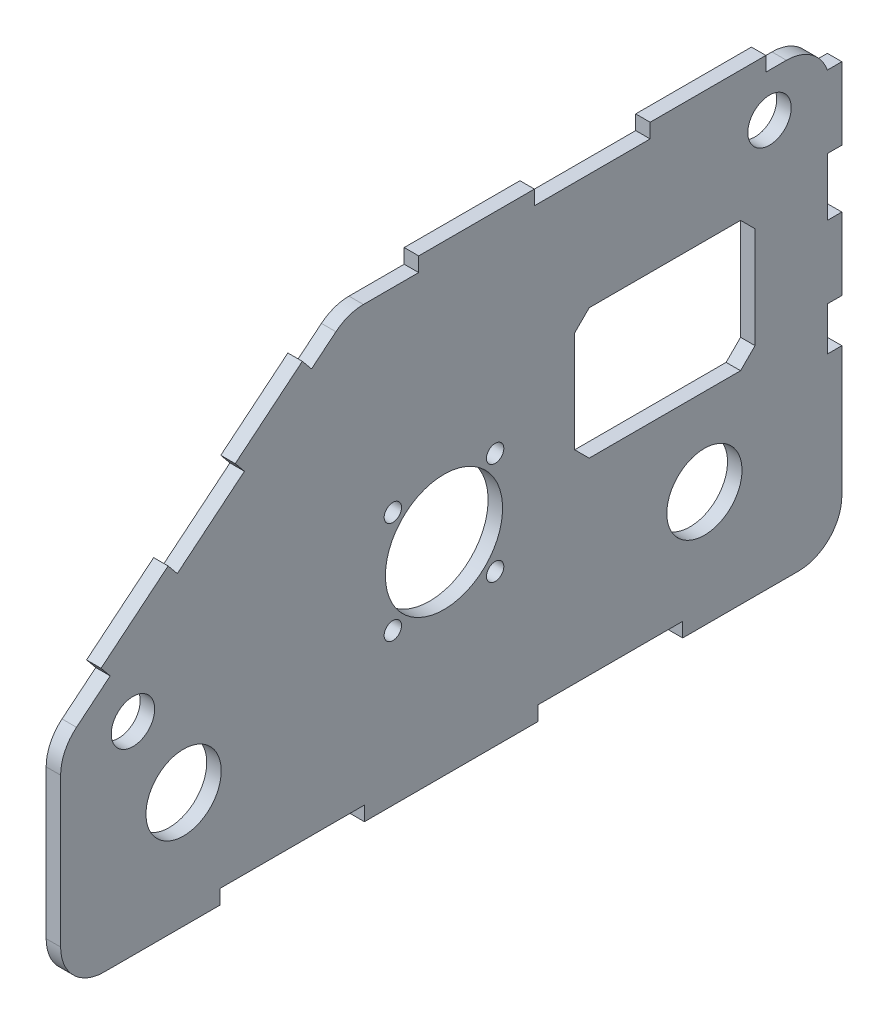
from build123d import *

# Parameters (mm, degrees)
ESQUISSE1_R             = 15
BOSS_EXTRU_1_DEPTH      = 10
ESQUISSE5_R             = 40.5
ESQUISSE5_R_2           = 6
ENL_V_MAT_EXTRU_1_DEPTH = 10
ESQUISSE6_R             = 26
ENL_V_MAT_EXTRU_2_DEPTH = 10
ENL_V_MAT_EXTRU_3_DEPTH = 10
CONG_1_R                = 30
ENL_V_MAT_EXTRU_4_DEPTH = 10


with BuildPart() as part:
    # Esquisse1 → Boss.-Extru.1 (new body)
    with BuildSketch(Plane(origin=(0, 0, 0), x_dir=(0, 0, -1), z_dir=(1, 0, 0))):
        Polygon((540, 0), (540, 310), (195, 310), (0, 150), (0, 0), (0, -10), (110, -10), (110, 0), (210, 0), (210, -10), (330, -10), (330, 0), (430, 0), (430, -10), (540, -10), align=None)
        with Locations((490, 270)):
            Circle(ESQUISSE1_R, mode=Mode.SUBTRACT)
        with Locations((50, 130)):
            Circle(ESQUISSE1_R, mode=Mode.SUBTRACT)
    extrude(amount=BOSS_EXTRU_1_DEPTH)

    # Esquisse5 → Enlèv. mat.-Extru.1 (cut)
    with BuildSketch(Plane.ZY):
        with Locations((-265, 130)):
            Circle(ESQUISSE5_R)
        with Locations((-300.35, 94.65)):
            Circle(ESQUISSE5_R_2)
        with Locations((-300.35, 165.35)):
            Circle(ESQUISSE5_R_2)
        with Locations((-229.65, 165.35)):
            Circle(ESQUISSE5_R_2)
        with Locations((-229.65, 94.65)):
            Circle(ESQUISSE5_R_2)
    extrude(amount=-ENL_V_MAT_EXTRU_1_DEPTH, mode=Mode.SUBTRACT)

    # Esquisse6 → Enlèv. mat.-Extru.2 (cut)
    with BuildSketch(Plane.ZY):
        with Locations((-445, 70)):
            Circle(ESQUISSE6_R)
        with Locations(Location((-85, 70, 0), (0, 0, 180))):
            Circle(ESQUISSE6_R)
    extrude(amount=-ENL_V_MAT_EXTRU_2_DEPTH, mode=Mode.SUBTRACT)

    # Esquisse7 → Enlèv. mat.-Extru.3 (cut)
    with BuildSketch(Plane.ZY):
        Polygon((-198.57749782, 300), (-247.5, 300), (-247.5, 310), (-327.5, 310), (-327.5, 300), (-407.5, 300), (-407.5, 310), (-487.5, 310), (-487.5, 300), (-530, 300), (-530, 280), (-540, 280), (-540, 230), (-530, 230), (-530, 190), (-540, 190), (-540, 140), (-530, 140), (-530, 110), (-794.780536076, 110), (-794.780536076, 495.732813741), (95.631773419, 495.732813741), (95.631773419, 137.064617174), (0, 137.064617174), (-34.266562773, 165.180771244), (-27.923396657, 172.911504949), (-74.307798886, 210.97050165), (-80.650965002, 203.239767945), (-127.035367231, 241.298764646), (-120.692201114, 249.02949835), (-167.076603343, 287.088495051), (-173.41976946, 279.357761346), align=None)
    extrude(amount=-ENL_V_MAT_EXTRU_3_DEPTH, mode=Mode.SUBTRACT)

    # Congé1
    # the kernel refuses this fillet: 30 mm, written as the material it takes off along each edge
    with BuildSketch(Plane(origin=(-75, -10, -540), x_dir=(0, 1, 0), z_dir=(1, 0, 0)), Plane(origin=(-75, -10, 0), x_dir=(0, 0, -1), z_dir=(1, 0, 0))) as cong_1_piece_1:
        with BuildLine():
            CenterArc((CONG_1_R, CONG_1_R), CONG_1_R, 180, 90)
            Line((0, CONG_1_R), (-CONG_1_R * 0.02, CONG_1_R))
            Line((-CONG_1_R * 0.02, CONG_1_R), (-CONG_1_R * 0.02, -CONG_1_R * 0.02))
            Line((-CONG_1_R * 0.02, -CONG_1_R * 0.02), (CONG_1_R, -CONG_1_R * 0.02))
            Line((CONG_1_R, -CONG_1_R * 0.02), (CONG_1_R, 0))
        make_face()
    extrude(amount=160, mode=Mode.SUBTRACT)
    with BuildSketch(Plane(origin=(-70.710678119, 300, -530), x_dir=(0, -1, 0), z_dir=(1, 0, 0))) as cong_1_piece_2:
        with BuildLine():
            CenterArc((30, -28.284271247), CONG_1_R, 109.471220634, 70.528779366)
            Line((0, -28.284271247), (-0.6, -28.284271247))
            Line((-0.6, -28.284271247), (-0.6, 0))
            Line((-0.6, 0), (0, 0.6))
            ThreePointArc((0, 0.6), (10, 0.6), (19.8, 0.565685425))
            Line((19.8, 0.565685425), (20, 0))
        make_face()
    extrude(amount=151.421356237, mode=Mode.SUBTRACT)
    with BuildSketch(Plane(origin=(-35.476909659, 137.064617174, 0), x_dir=(0, -1, 0), z_dir=(1, 0, 0))) as cong_1_piece_3:
        with BuildLine():
            CenterArc((CONG_1_R * 0.473025462116, CONG_1_R), CONG_1_R, 219.369317242, 50.630682758)
            Line((-CONG_1_R * 0.300047908367, CONG_1_R * 0.365683388322), (-CONG_1_R * 0.315509375776, CONG_1_R * 0.352997056088))
            Line((-CONG_1_R * 0.315509375776, CONG_1_R * 0.352997056088), (-CONG_1_R * 0.00946050924232, -CONG_1_R * 0.02))
            Line((-CONG_1_R * 0.00946050924232, -CONG_1_R * 0.02), (CONG_1_R * 0.473025462116, -CONG_1_R * 0.02))
            Line((CONG_1_R * 0.473025462116, -CONG_1_R * 0.02), (CONG_1_R * 0.473025462116, 0))
        make_face()
    extrude(amount=80.953819317, mode=Mode.SUBTRACT)
    with BuildSketch(Plane(origin=(-26.831233647, 300, -198.57749782), x_dir=(0, -0.634316611678022, 0.7730733704825911), z_dir=(1, 0, 0))) as cong_1_piece_4:
        with BuildLine():
            CenterArc((CONG_1_R * 0.357749781954, CONG_1_R), CONG_1_R, 230.630682758, 39.369317242)
            Line((-CONG_1_R * 0.276566829724, CONG_1_R * 0.226926629517), (-CONG_1_R * 0.289253161958, CONG_1_R * 0.211465162108))
            Line((-CONG_1_R * 0.289253161958, CONG_1_R * 0.211465162108), (-CONG_1_R * 0.00715499563907, -CONG_1_R * 0.02))
            Line((-CONG_1_R * 0.00715499563907, -CONG_1_R * 0.02), (CONG_1_R * 0.357749781954, -CONG_1_R * 0.02))
            Line((CONG_1_R * 0.357749781954, -CONG_1_R * 0.02), (CONG_1_R * 0.357749781954, 0))
        make_face()
    extrude(amount=63.662467293, mode=Mode.SUBTRACT)

    # Esquisse8 → Enlèv. mat.-Extru.4 (cut)
    with BuildSketch(Plane.ZY):
        Polygon((-355.35, 210), (-365.35, 220), (-470, 220), (-480, 210), (-480, 140), (-470, 130), (-365.35, 130), (-355.35, 140), align=None)
    extrude(amount=-ENL_V_MAT_EXTRU_4_DEPTH, mode=Mode.SUBTRACT)


solid = part.part
